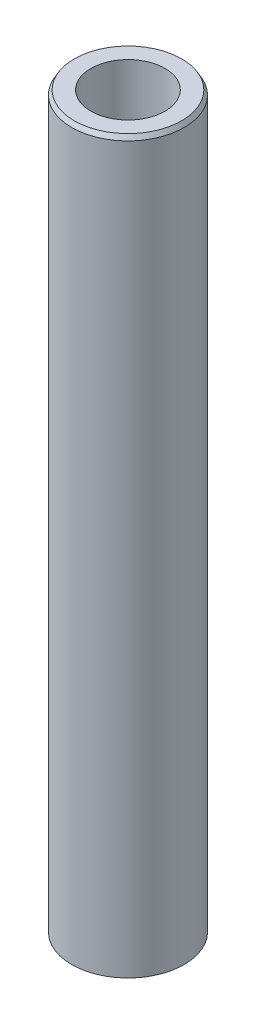
from build123d import *
from OCP.BRepFilletAPI import BRepFilletAPI_MakeChamfer

# Parameters (mm, degrees)
SKETCH1_R           = 17.5
BOSS_EXTRUDE1_DEPTH = 227.662841824
SKETCH2_R           = 11.524401394
CUT_EXTRUDE1_DEPTH  = 230.004081944
CHAMFER1_SIZE       = 1.402553394
CHAMFER1_SIZE2      = 0.80976458


with BuildPart() as part:
    # Sketch1 → Boss-Extrude1 (new body)
    with BuildSketch(Plane(origin=(0, 0, 0), x_dir=(1, 0, 0), z_dir=(0, 1, 0))):
        Circle(SKETCH1_R)
    extrude(amount=BOSS_EXTRUDE1_DEPTH)

    # Sketch2 → Cut-Extrude1 (cut, through all)
    with BuildSketch(Plane(origin=(0, 0, 0), x_dir=(1, 0, 0), z_dir=(0, 1, 0))):
        Circle(SKETCH2_R)
    extrude(amount=CUT_EXTRUDE1_DEPTH, mode=Mode.SUBTRACT)

    # Chamfer1: one chamfer whose edges measure the first distance from different faces: ONE call of the kernel's chamfer builder (chamfer() names one face for all edges)
    chamfer1_edges_1 = [part.edges().sort_by_distance(p)[0] for p in [
        (-17.5, 227.662841824, 0),
    ]]
    chamfer1_side_1 = [part.faces().sort_by_distance(p)[0] for p in [
        (-17.5, 113.831420912, 0),
    ]]
    chamfer1_edges_2 = [part.edges().sort_by_distance(p)[0] for p in [
        (-17.5, 0, 0),
    ]]
    chamfer1_side_2 = [part.faces().sort_by_distance(p)[0] for p in [
        (-17.005025253, 0, 0),
    ]]
    chamfer1 = BRepFilletAPI_MakeChamfer(part.part.solid().wrapped)
    for e in chamfer1_edges_1:
        chamfer1.Add(CHAMFER1_SIZE, CHAMFER1_SIZE2, e.wrapped, chamfer1_side_1[0].wrapped)  # the first distance lies on this face
    for e in chamfer1_edges_2:
        chamfer1.Add(CHAMFER1_SIZE, CHAMFER1_SIZE2, e.wrapped, chamfer1_side_2[0].wrapped)  # the first distance lies on this face
    add(Compound.cast(chamfer1.Shape()), mode=Mode.REPLACE)


solid = part.part
